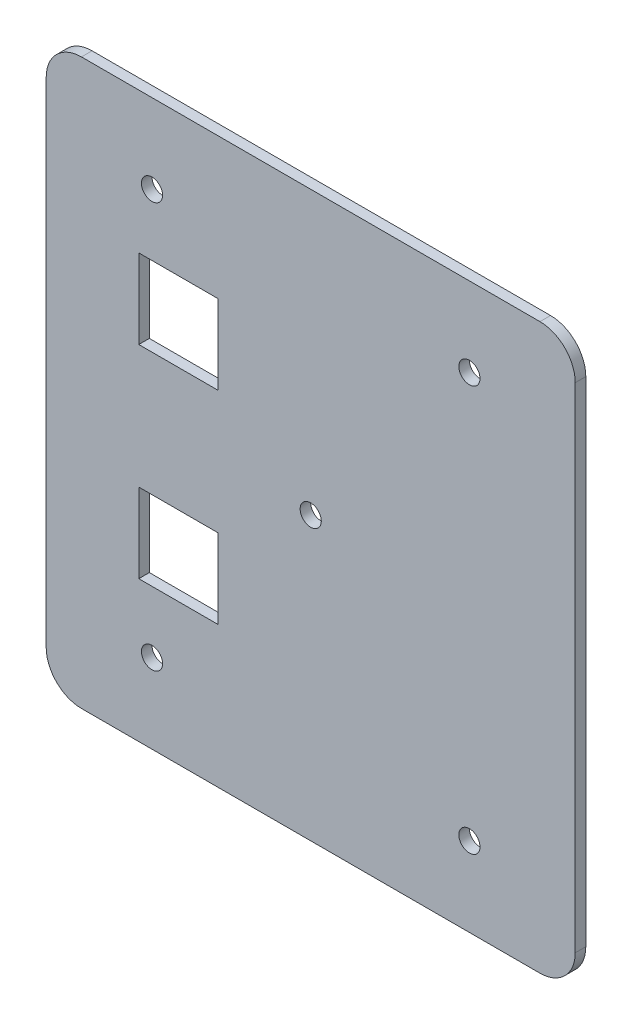
from build123d import *

# Parameters (mm, degrees)
SKETCH1_R           = 6
SKETCH1_W           = 45
SKETCH1_H           = 45
BOSS_EXTRUDE1_DEPTH = 6


with BuildPart() as part:
    # Sketch1 → Boss-Extrude1 (new body)
    with BuildSketch(Plane.XY):
        with BuildLine():
            ThreePointArc((205, -102.5), (219.142135624, -96.642135624), (225, -82.5))
            Line((225, -82.5), (225, 197.5))
            ThreePointArc((225, 197.5), (219.142135624, 211.642135624), (205, 217.5))
            Line((205, 217.5), (-55, 217.5))
            ThreePointArc((-55, 217.5), (-69.142135624, 211.642135624), (-75, 197.5))
            Line((-75, 197.5), (-75, -82.5))
            ThreePointArc((-75, -82.5), (-69.142135624, -96.642135624), (-55, -102.5))
            Line((-55, -102.5), (205, -102.5))
        make_face()
        with Locations((-15, -57.5)):
            Circle(SKETCH1_R, mode=Mode.SUBTRACT)
        with Locations((-15, 172.5)):
            Circle(SKETCH1_R, mode=Mode.SUBTRACT)
        with Locations((75, 57.5)):
            Circle(SKETCH1_R, mode=Mode.SUBTRACT)
        Polygon((22.5, -22.5), (-22.5, -22.5), (-22.5, 22.5), (0, 22.5), (22.5, 22.5), align=None, mode=Mode.SUBTRACT)
        with Locations((0, 115)):
            Rectangle(SKETCH1_W, SKETCH1_H, mode=Mode.SUBTRACT)
        with Locations((165, 172.5)):
            Circle(SKETCH1_R, mode=Mode.SUBTRACT)
        with Locations((165, -57.5)):
            Circle(SKETCH1_R, mode=Mode.SUBTRACT)
    extrude(amount=BOSS_EXTRUDE1_DEPTH)


solid = part.part
